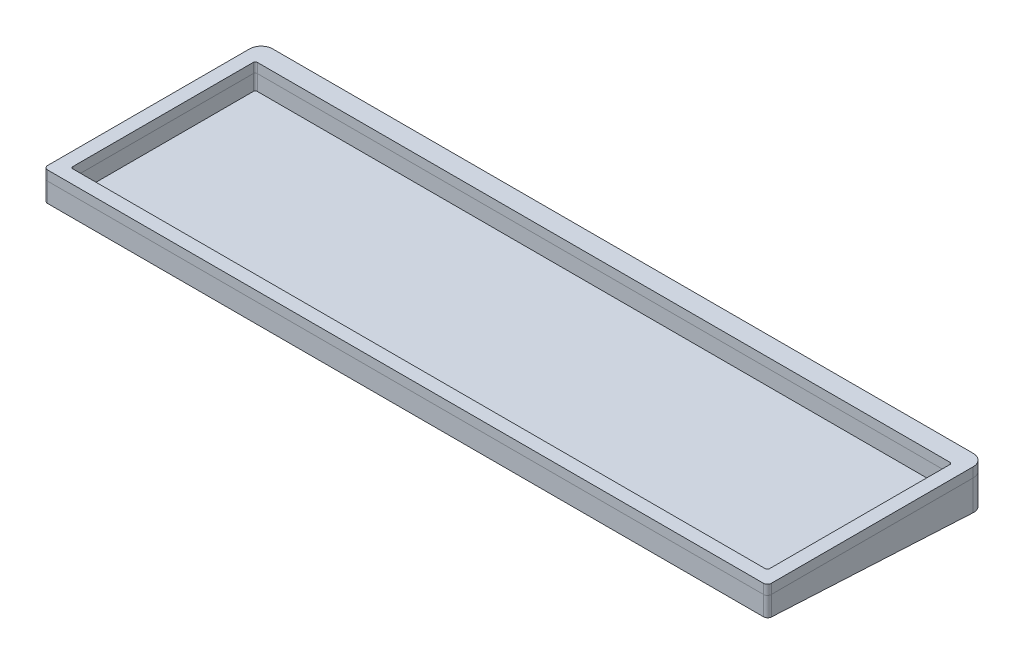
from build123d import *

# Parameters (mm, degrees)
BOSS_EXTRUDE1_DEPTH = 13
BOSS_EXTRUDE3_START = 10.5
BOSS_EXTRUDE3_DEPTH = 10.5
CUT_EXTRUDE4_DEPTH  = 400


with BuildPart() as part:
    # Sketch2 → Boss-Extrude1 (new body)
    with BuildSketch(Plane(origin=(0, 0, 0), x_dir=(1, 0, 0), z_dir=(0, 1, 0))):
        with BuildLine():
            Line((180.825, 57.625), (-180.825, 57.625))
            ThreePointArc((-180.825, 57.625), (-185.067640687, 55.867640687), (-186.825, 51.625))
            Line((-186.825, 51.625), (-186.825, -52.625))
            ThreePointArc((-186.825, -52.625), (-186.239213562, -54.039213562), (-184.825, -54.625))
            Line((-184.825, -54.625), (184.825, -54.625))
            ThreePointArc((184.825, -54.625), (186.239213562, -54.039213562), (186.825, -52.625))
            Line((186.825, -52.625), (186.825, 51.625))
            ThreePointArc((186.825, 51.625), (185.067640687, 55.867640687), (180.825, 57.625))
        make_face()
        with BuildLine():
            Line((-179.825, -46.625), (-179.825, 46.625))
            ThreePointArc((-179.825, 46.625), (-179.532106781, 47.332106781), (-178.825, 47.625))
            Line((-178.825, 47.625), (178.825, 47.625))
            ThreePointArc((178.825, 47.625), (179.532106781, 47.332106781), (179.825, 46.625))
            Line((179.825, 46.625), (179.825, -46.625))
            ThreePointArc((179.825, -46.625), (179.532106781, -47.332106781), (178.825, -47.625))
            Line((178.825, -47.625), (-178.825, -47.625))
            ThreePointArc((-178.825, -47.625), (-179.532106781, -47.332106781), (-179.825, -46.625))
        make_face(mode=Mode.SUBTRACT)
    extrude(amount=BOSS_EXTRUDE1_DEPTH)

    # Sketch4 → Boss-Extrude3 (add)
    with BuildSketch(Plane.XZ.offset(BOSS_EXTRUDE3_START)):
        with BuildLine():
            ThreePointArc((180.825, -57.625), (185.067640687, -55.867640687), (186.825, -51.625))
            Line((186.825, -51.625), (186.825, 52.625))
            ThreePointArc((186.825, 52.625), (186.239213562, 54.039213562), (184.825, 54.625))
            Line((184.825, 54.625), (-184.825, 54.625))
            ThreePointArc((-184.825, 54.625), (-186.239213562, 54.039213562), (-186.825, 52.625))
            Line((-186.825, 52.625), (-186.825, -51.625))
            ThreePointArc((-186.825, -51.625), (-185.067640687, -55.867640687), (-180.825, -57.625))
            Line((-180.825, -57.625), (180.825, -57.625))
        make_face()
    extrude(amount=-BOSS_EXTRUDE3_DEPTH)

    # Sketch8 → Cut-Extrude4 (cut)
    with BuildSketch(Plane.ZY.offset(186.825)):
        Polygon((-57.625, -7.882773225), (-57.625, -10.5), (54.625, -10.5), (54.625, -2), align=None)
    extrude(amount=-CUT_EXTRUDE4_DEPTH, mode=Mode.SUBTRACT)


with BuildPart() as body_2:
    # Split1: the piece on the far side of the plane
    add(part.part)
    split(bisect_by=Plane.ZX.offset(8), keep=Keep.BOTTOM)


with BuildPart() as part_1:
    add(part.part)

    # Split1
    split(bisect_by=Plane.ZX.offset(8), keep=Keep.TOP)


solid = Compound([body_2.part, part_1.part])
